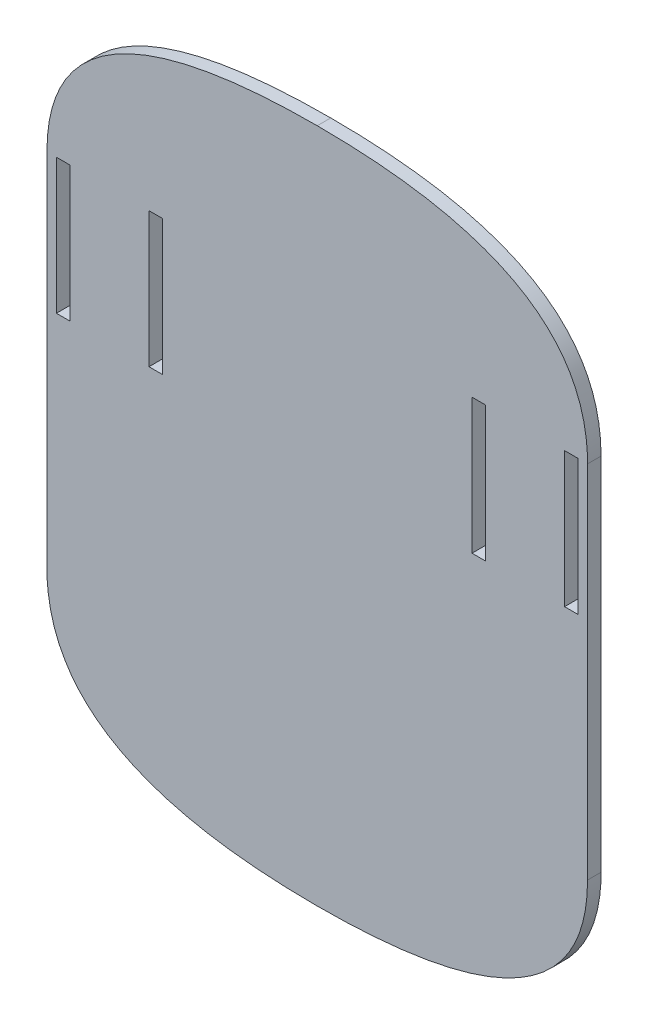
from build123d import *

# Parameters (mm, degrees)
SKETCH1_W           = 203.2
SKETCH1_H           = 254
BOSS_EXTRUDE1_DEPTH = 5.08
FILLET1_SIZE        = 59.266666667
FILLET1_SIZE_2      = 101.6
SKETCH7_W           = 5.08
SKETCH7_H           = 50.8
CUT_EXTRUDE1_DEPTH  = 326.318377121


with BuildPart() as part:
    # Sketch1 → Boss-Extrude1 (new body)
    with BuildSketch(Plane.XY):
        with Locations((101.6, 127)):
            Rectangle(SKETCH1_W, SKETCH1_H)
    extrude(amount=BOSS_EXTRUDE1_DEPTH)

    # Fillet1
    # a fillet whose section is not a circle: 101.6, 59.266666667 mm, written as the material it takes off along each edge
    with BuildSketch(Plane(origin=(203.2, 254, -254), x_dir=(0, -1, 0), z_dir=(0, 0, 1))) as fillet1_piece_1:
        with BuildLine():
            Bezier((FILLET1_SIZE, 0), (0, 0), (0, -FILLET1_SIZE_2), weights=[1, 1, 1])
            Line((0, -FILLET1_SIZE_2), (0, 0))
            Line((0, 0), (FILLET1_SIZE, 0))
        make_face()
    extrude(amount=513.08, mode=Mode.SUBTRACT)
    with BuildSketch(Plane(origin=(0, 254, -254), x_dir=(1, 0, 0), z_dir=(0, 0, 1)), Plane(origin=(203.2, 0, -254), x_dir=(-1, 0, 0), z_dir=(0, 0, 1))) as fillet1_piece_2:
        with BuildLine():
            Bezier((FILLET1_SIZE_2, 0), (0, 0), (0, -FILLET1_SIZE), weights=[1, 1, 1])
            Line((0, -FILLET1_SIZE), (0, 0))
            Line((0, 0), (FILLET1_SIZE_2, 0))
        make_face()
    extrude(amount=513.08, mode=Mode.SUBTRACT)
    with BuildSketch(Plane(origin=(0, 0, -254), x_dir=(1, 0, 0), z_dir=(0, 0, 1))) as fillet1_piece_3:
        with BuildLine():
            Bezier((FILLET1_SIZE_2, 0), (0, 0), (0, FILLET1_SIZE), weights=[1, 1, 1])
            Line((0, FILLET1_SIZE), (0, 0))
            Line((0, 0), (FILLET1_SIZE_2, 0))
        make_face()
    extrude(amount=513.08, mode=Mode.SUBTRACT)

    # Sketch7 → Cut-Extrude1 (cut, through all)
    with BuildSketch(Plane.XY.offset(5.08)):
        with Locations((6.096, 169.333333333)):
            Rectangle(SKETCH7_W, SKETCH7_H)
        with Locations((40.894, 169.333333333)):
            Rectangle(SKETCH7_W, SKETCH7_H)
        with Locations((197.104, 169.333333333)):
            Rectangle(SKETCH7_W, SKETCH7_H)
        with Locations((162.306, 169.333333333)):
            Rectangle(SKETCH7_W, SKETCH7_H)
    extrude(amount=-CUT_EXTRUDE1_DEPTH, mode=Mode.SUBTRACT)


solid = part.part
